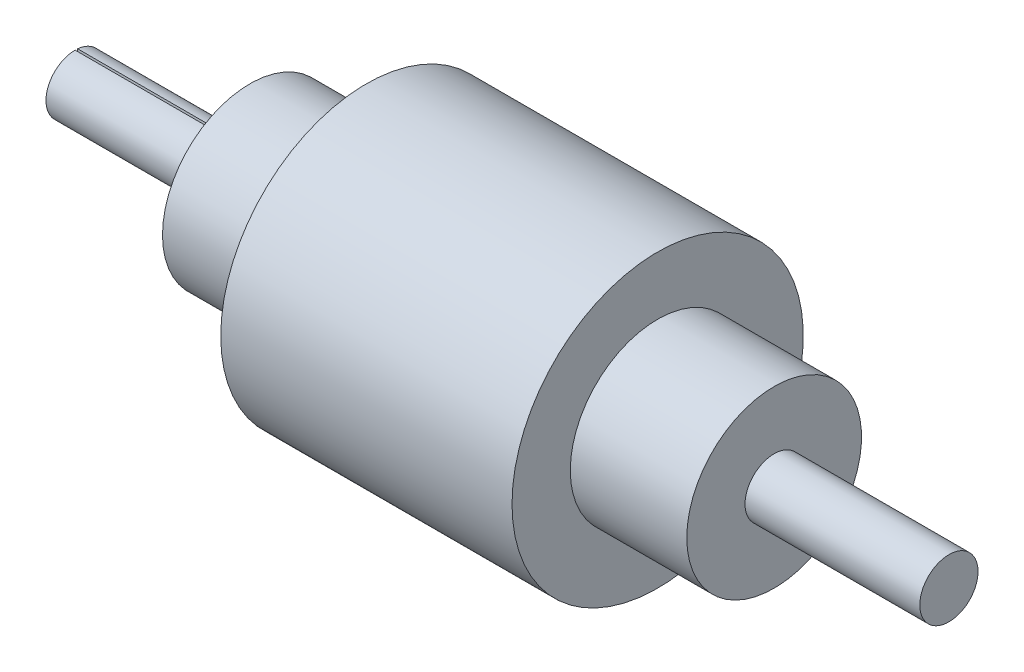
from build123d import *

# Parameters (mm, degrees)
REVOLVE_THIN4_START = -152.206983034
REVOLVE_THIN4_DEPTH = 60
SKETCH1_7_W         = 60
SKETCH1_7_H         = 10


# Read off the part's stored shape, not the designer's step: Revolve-Thin4
with BuildPart() as part:
    # Revolve-Thin4 outline → Revolve-Thin4 (new body)
    with BuildSketch(Plane.YZ.offset(REVOLVE_THIN4_START)):
        with BuildLine():
            ThreePointArc((10, 0), (-9.990482216, 0.436193872), (9.961946981, -0.871557427))
            Line((9.961946981, -0.871557427), (0, 0))
            Line((0, 0), (10, 0))
        make_face()
    extrude(amount=REVOLVE_THIN4_DEPTH)

    # Sketch1<7> → Revolve2 (revolve)
    with BuildSketch(Plane.XY, mode=Mode.PRIVATE) as revolve2_sk:
        Polygon((-92.206983034, 10), (-92.206983034, 0), (-52.206983034, 0), (-52.206983034, 30), (-92.206983034, 30), align=None)
        Polygon((-52.206983034, 30), (-52.206983034, 0), (47.793016966, 0), (47.793016966, 30), (47.793016966, 50), (-52.206983034, 50), align=None)
        Polygon((47.793016966, 30), (47.793016966, 0), (87.793016966, 0), (87.793016966, 10), (87.793016966, 30), align=None)
        with Locations((117.793016966, 5)):
            Rectangle(SKETCH1_7_W, SKETCH1_7_H)
    revolve(revolve2_sk.sketch.rotate(Axis((-163.404059647, 0, 0), (1, 0, 0)), 90), axis=Axis((-163.404059647, 0, 0), (1, 0, 0)))


solid = part.part
